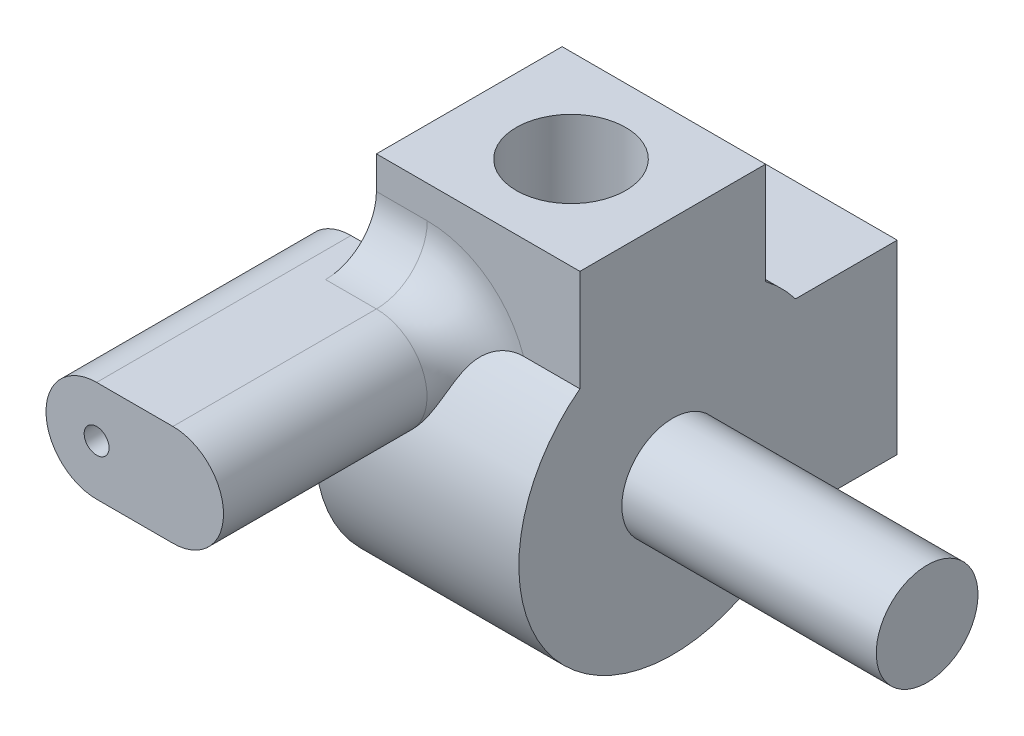
from build123d import *

# Parameters (mm, degrees)
SKETCH1_R               = 1.75
BOSS_EXTRUDE1_DEPTH     = 4
SKETCH2_R               = 2.15
CUT_EXTRUDE1_DEPTH      = 5
BOSS_EXTRUDE5_START     = -1.8499999
BOSS_EXTRUDE5_OUTLINE_R = 2
BOSS_EXTRUDE5_DEPTH     = 11.8499999
BOSS_EXTRUDE5_START_2   = -3
BOSS_EXTRUDE5_2_DEPTH   = 7.824935333
SKETCH3_R               = 2.15
CUT_EXTRUDE2_DEPTH      = 5
BOSS_EXTRUDE2_START     = 4
SKETCH4_W               = 8
SKETCH4_H               = 7.3
SKETCH4_R               = 2.15
BOSS_EXTRUDE2_DEPTH     = 4
BOSS_EXTRUDE3_START     = 4
SKETCH5_W               = 8
SKETCH5_H               = 7.3
SKETCH5_R               = 2.15
BOSS_EXTRUDE3_DEPTH     = 4
SKETCH6_R               = 0.4895
BOSS_EXTRUDE4_DEPTH     = 10
FILLET1_R               = 2


with BuildPart() as part:
    # Sketch1 → Boss-Extrude1 (new, symmetric)
    with BuildSketch(Plane(origin=(0, 0, 0), x_dir=(0, 0, -1), z_dir=(1, 0, 0))):
        with BuildLine():
            Line((-3.65, 4.824935233), (3.65, 4.824935233))
            ThreePointArc((3.65, 4.824935233), (4.277996026, 4.277996026), (4.824935233, 3.65))
            Line((4.824935233, 3.65), (4.824935233, -3.65))
            ThreePointArc((4.824935233, -3.65), (-4.277996026, -4.277996026), (-3.65, 4.824935233))
        make_face()
        Circle(SKETCH1_R, mode=Mode.SUBTRACT)
    extrude(amount=BOSS_EXTRUDE1_DEPTH, both=True)

    # Sketch2 → Cut-Extrude1 (cut)
    with BuildSketch(Plane(origin=(0, 4.824935233, 0), x_dir=(1, 0, 0), z_dir=(0, 1, 0))):
        with Locations(Location((0, 0, 0), (0, 0, 270))):
            Circle(SKETCH2_R)
    extrude(amount=-CUT_EXTRUDE1_DEPTH, mode=Mode.SUBTRACT)

    # Boss-Extrude5: read off the stored shape, not the designer's step
    # Boss-Extrude5 outline → Boss-Extrude5 (add)
    with BuildSketch(Plane(origin=(4, 0, 0), x_dir=(0, 0, -1), z_dir=(1, 0, 0)).offset(BOSS_EXTRUDE5_START)):
        Circle(BOSS_EXTRUDE5_OUTLINE_R)
    extrude(amount=BOSS_EXTRUDE5_DEPTH)

    # Boss-Extrude5 2 outline → Boss-Extrude5 2 (add)
    with BuildSketch(Plane(origin=(0, 0, 0), x_dir=(1, 0, 0), z_dir=(0, 1, 0)).offset(BOSS_EXTRUDE5_START_2)):
        with BuildLine():
            Line((2.1500001, -3), (2.15, 0))
            ThreePointArc((2.15, 0), (1.52027958, -1.52027958), (0, -2.15))
            Line((0, -2.15), (0, -3))
            Line((0, -3), (2.1500001, -3))
        make_face()
        with BuildLine():
            ThreePointArc((0, 2.15), (1.52027958, 1.52027958), (2.15, 0))
            Line((2.15, 0), (2.1500001, 3))
            Line((2.1500001, 3), (0, 3))
            Line((0, 3), (0, 2.15))
        make_face()
    extrude(amount=BOSS_EXTRUDE5_2_DEPTH)

    # Sketch3 → Cut-Extrude2 (cut)
    with BuildSketch(Plane(origin=(0, 0, -4.824935233), x_dir=(-1, 0, 0), z_dir=(0, 0, -1))):
        Circle(SKETCH3_R)
    extrude(amount=-CUT_EXTRUDE2_DEPTH, mode=Mode.SUBTRACT)

    # Sketch4 → Boss-Extrude2 (add)
    with BuildSketch(Plane(origin=(0, 4.824935233, 0), x_dir=(1, 0, 0), z_dir=(0, 1, 0)).offset(BOSS_EXTRUDE2_START)):
        Rectangle(SKETCH4_W, SKETCH4_H)
        with Locations(Location((0, 0, 0), (0, 0, 270))):
            Circle(SKETCH4_R, mode=Mode.SUBTRACT)
    extrude(amount=-BOSS_EXTRUDE2_DEPTH)

    # Sketch5 → Boss-Extrude3 (add)
    with BuildSketch(Plane(origin=(0, 0, -4.824935233), x_dir=(-1, 0, 0), z_dir=(0, 0, -1)).offset(BOSS_EXTRUDE3_START)):
        Rectangle(SKETCH5_W, SKETCH5_H)
        Circle(SKETCH5_R, mode=Mode.SUBTRACT)
    extrude(amount=-BOSS_EXTRUDE3_DEPTH)

    # Sketch6 → Boss-Extrude4 (add)
    with BuildSketch(Plane.XY.offset(3.65)):
        with BuildLine():
            Line((-2, 5.5445), (-5, 5.5445))
            ThreePointArc((-5, 5.5445), (-6.9895, 3.555), (-5, 1.5655))
            Line((-5, 1.5655), (-2, 1.5655))
            ThreePointArc((-2, 1.5655), (-0.0105, 3.555), (-2, 5.5445))
        make_face()
        with Locations((-5, 3.555)):
            Circle(SKETCH6_R, mode=Mode.SUBTRACT)
    extrude(amount=BOSS_EXTRUDE4_DEPTH)

    # Fillet1
    # the kernel refuses this fillet: 2 mm, written as the material it adds along each edge
    with BuildSketch(Plane(origin=(-2, 3.555, 3.65), x_dir=(-0.2477928617675286, -0.9688130354495952, 0), z_dir=(-0.9688130354495952, 0.2477928617675286, 0))) as fillet1_piece_1:
        with BuildLine():
            CenterArc((1.9895 + FILLET1_R, FILLET1_R), FILLET1_R, 180, 90)
            Line((1.9895 + FILLET1_R, 0), (1.9895, 0))
            Line((1.9895, 0), (1.9895, FILLET1_R))
        make_face()
    revolve(axis=Axis((-2, 3.555, 3.65), (0, 0, 1)), revolution_arc=194.346943464)
    with BuildSketch(Plane(origin=(-2, 5.5445, 3.65), x_dir=(0, 0, 1), z_dir=(-1, 0, 0))) as fillet1_piece_2:
        with BuildLine():
            CenterArc((FILLET1_R, FILLET1_R), FILLET1_R, 180, 90)
            Line((0, FILLET1_R), (0, 0))
            Line((0, 0), (FILLET1_R, 0))
        make_face()
    extrude(amount=2)


solid = part.part
